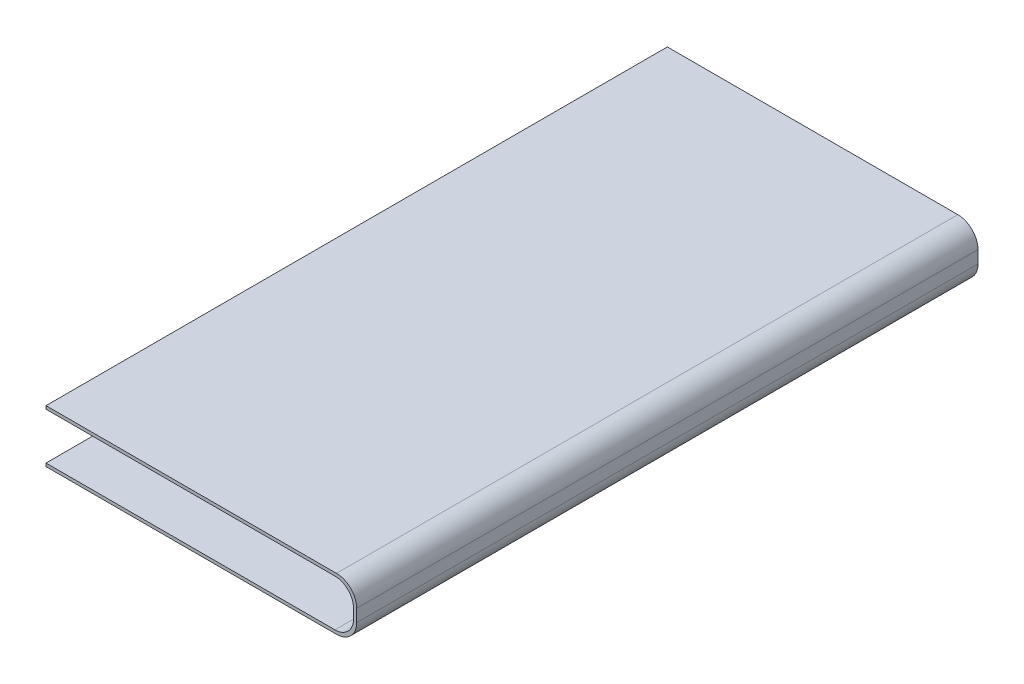
from build123d import *

# Parameters (mm, degrees)
EXTRUDE_1_DEPTH = 10


with BuildPart() as part:
    # Эскиз1 → Бобышка-Вытянуть1 (new, symmetric)
    with BuildSketch(Plane.XY):
        with BuildLine():
            Line((14.5, -1.65), (23.85, -1.65))
            ThreePointArc((23.85, -1.65), (24.309619408, -1.840380592), (24.5, -2.3))
            Line((24.5, -2.3), (24.5, -2.7))
            ThreePointArc((24.5, -2.7), (24.309619408, -3.159619408), (23.85, -3.35))
            Line((23.85, -3.35), (14.5, -3.35))
            Line((14.5, -3.35), (14.5, -3.25))
            Line((14.5, -3.25), (23.8, -3.25))
            ThreePointArc((23.8, -3.25), (24.224264069, -3.074264069), (24.4, -2.65))
            Line((24.4, -2.65), (24.4, -2.35))
            ThreePointArc((24.4, -2.35), (24.224264069, -1.925735931), (23.8, -1.75))
            Line((23.8, -1.75), (14.5, -1.75))
            Line((14.5, -1.75), (14.5, -1.65))
        make_face()
    extrude(amount=EXTRUDE_1_DEPTH, both=True)


solid = part.part
